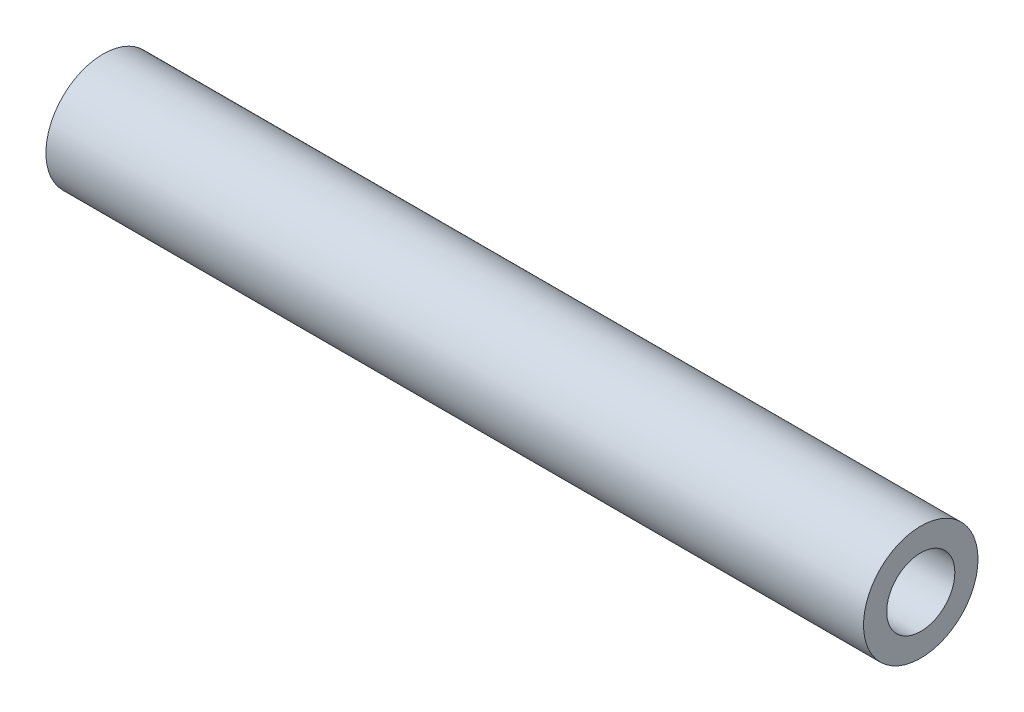
from build123d import *

# Parameters (mm, degrees)
SKETCH1_R           = 10.668
SKETCH1_R_2         = 6.35
BOSS_EXTRUDE1_DEPTH = 152.4


with BuildPart() as part:
    # Sketch1 → Boss-Extrude1 (new body)
    with BuildSketch(Plane(origin=(0, 0, 0), x_dir=(0, 0, -1), z_dir=(1, 0, 0))):
        Circle(SKETCH1_R)
        Circle(SKETCH1_R_2, mode=Mode.SUBTRACT)
    extrude(amount=-BOSS_EXTRUDE1_DEPTH)


solid = part.part
